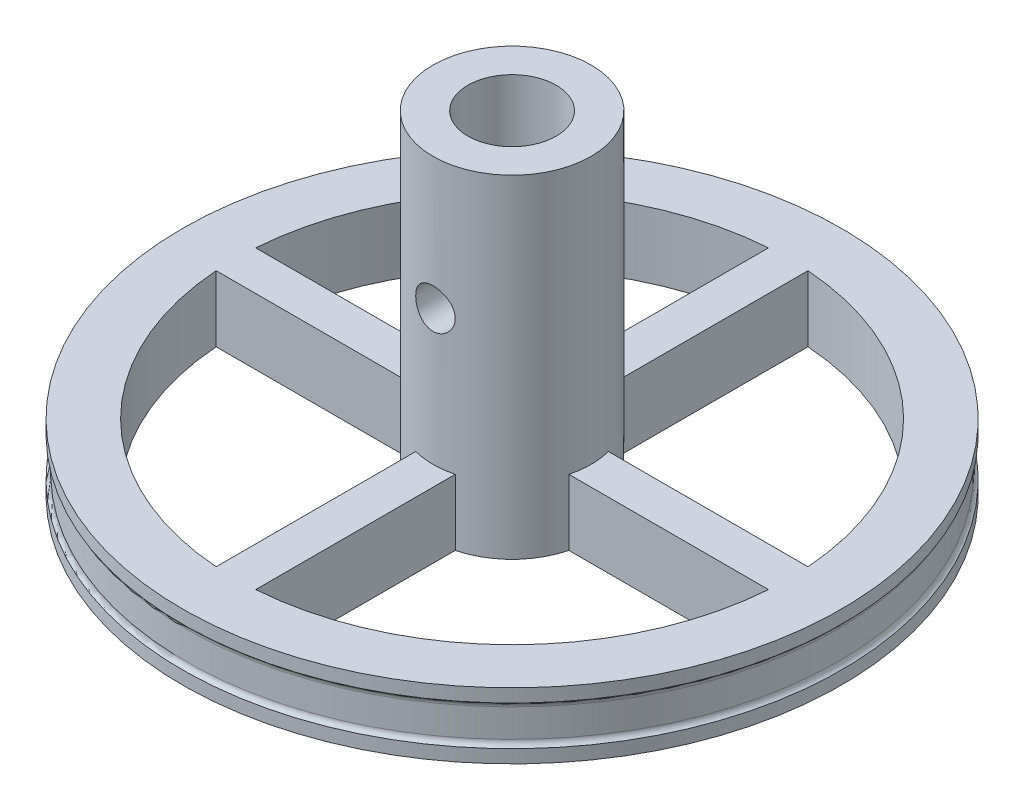
from build123d import *

# Parameters (mm, degrees)
REVOLVE1_ANGLE                 = 90.0000000000002
BOSS_EXTRUDE2_DEPTH            = 22.5
CUT_EXTRUDE1_DEPTH             = 41.736973886583954
MIRROR3_START                  = -2.736132077
MIRROR3_DEPTH                  = 5
MIRROR3_START_2                = 2.263867923
MIRROR3_2_DEPTH                = 20.236132077
MIRROR3_3_DEPTH                = 1
MIRROR3_START_3                = 1.263867923
MIRROR3_4_DEPTH                = 1
MIRROR4_START                  = -2.736132077
MIRROR4_DEPTH                  = 5
MIRROR4_START_2                = 2.263867923
MIRROR4_2_DEPTH                = 20.236132077
MIRROR4_3_DEPTH                = 1
MIRROR4_START_3                = 1.263867923
MIRROR4_4_DEPTH                = 1
SKETCH7_R                      = 3.35
CUT_EXTRUDE2_DEPTH             = 20
FILLET9_R                      = 0.5
CUT_EXTRUDE3_REACH             = 43.908
SKETCH8_R                      = 1.5000000000000004
CUT_EXTRUDE3_DIRECTION_2_REACH = 43.908


# Read off the part's stored shape, not the designer's step: Mirror3, Mirror4
with BuildPart() as part:
    # Sketch1 → Revolve1 (revolve)
    with BuildSketch(Plane.XY):
        Polygon((0, 2.2638679230386933), (0, -2.7361320769613027), (25, -2.7361320769613027), (25.000000000000007, -1.736132076961303), (24.750000000000007, -1.736132076961303), (24.75, 1.2638679230386973), (25, 1.2638679230386973), (25, 2.2638679230386973), align=None)
    revolve(axis=Axis((0, 2.2638679230386933, 0), (0, -1, 0)), revolution_arc=REVOLVE1_ANGLE)

    # Sketch2 → Boss-Extrude2 (add)
    with BuildSketch(Plane(origin=(0, 0, 0), x_dir=(1, 0, 0), z_dir=(0, 1, 0))):
        with BuildLine():
            Line((0, 0), (6, 0))
            ThreePointArc((6, 0), (4.242640687119239, -4.242640687119332), (-1.3093e-13, -6))
            Line((-1.3093e-13, -6), (0, 0))
        make_face()
    extrude(amount=BOSS_EXTRUDE2_DEPTH)

    # Sketch6 → Cut-Extrude1 (cut, through all)
    with BuildSketch(Plane(origin=(0, 2.263867923038695, 0), x_dir=(1, 0, 0), z_dir=(0, 1, 0))):
        with BuildLine():
            Line((1.4999999999999127, -5.809475019311148), (1.4999999999999145, -20.946360065653423))
            ThreePointArc((1.4999999999999145, -20.946360065653423), (14.849242404917469, -14.849242404917533), (20.946360065653415, -1.5))
            Line((20.946360065653415, -1.5), (5.809475019311125, -1.5))
            ThreePointArc((5.809475019311125, -1.5), (4.242640687119254, -4.242640687119317), (1.4999999999999127, -5.809475019311148))
        make_face()
    extrude(amount=-CUT_EXTRUDE1_DEPTH, mode=Mode.SUBTRACT)

    # Mirror3 outline → Mirror3 (add)
    with BuildSketch(Plane(origin=(0, 0, 0), x_dir=(1, 0, 0), z_dir=(0, 1, 0)).offset(MIRROR3_START)):
        with BuildLine():
            ThreePointArc((24.75, 0), (17.500892834, 17.500892834), (0, 24.75))
            Line((0, 24.75), (0, 0))
            Line((0, 0), (24.75, 0))
        make_face()
        with BuildLine():
            Line((20.946360066, 1.5), (5.809475019, 1.5))
            ThreePointArc((5.809475019, 1.5), (4.242640687, 4.242640687), (1.5, 5.809475019))
            Line((1.5, 5.809475019), (1.5, 20.946360066))
            ThreePointArc((1.5, 20.946360066), (14.849242405, 14.849242405), (20.946360066, 1.5))
        make_face(mode=Mode.SUBTRACT)
    extrude(amount=MIRROR3_DEPTH)

    # Mirror3 2 outline → Mirror3 2 (add)
    with BuildSketch(Plane(origin=(0, 0, 0), x_dir=(1, 0, 0), z_dir=(0, 1, 0)).offset(MIRROR3_START_2)):
        with BuildLine():
            Line((0, 0), (6, 0))
            ThreePointArc((6, 0), (4.242640687, 4.242640687), (0, 6))
            Line((0, 6), (0, 0))
        make_face()
    extrude(amount=MIRROR3_2_DEPTH)

    # Mirror3 3 outline → Mirror3 3 (add)
    with BuildSketch(Plane(origin=(0, 0, 0), x_dir=(1, 0, 0), z_dir=(0, 1, 0)).offset(MIRROR3_START)):
        with BuildLine():
            Line((24.75, 0), (25, 0))
            ThreePointArc((25, 0), (17.67766953, 17.67766953), (0, 25))
            Line((0, 25), (0, 24.75))
            ThreePointArc((0, 24.75), (17.500892834, 17.500892834), (24.75, 0))
        make_face()
    extrude(amount=MIRROR3_3_DEPTH)

    # Mirror3 4 outline → Mirror3 4 (add)
    with BuildSketch(Plane(origin=(0, 0, 0), x_dir=(1, 0, 0), z_dir=(0, 1, 0)).offset(MIRROR3_START_3)):
        with BuildLine():
            Line((24.75, 0), (25, 0))
            ThreePointArc((25, 0), (17.67766953, 17.67766953), (0, 25))
            Line((0, 25), (0, 24.75))
            ThreePointArc((0, 24.75), (17.500892834, 17.500892834), (24.75, 0))
        make_face()
    extrude(amount=MIRROR3_4_DEPTH)

    # Mirror4 outline → Mirror4 (add)
    with BuildSketch(Plane(origin=(0, 0, 0), x_dir=(1, 0, 0), z_dir=(0, 1, 0)).offset(MIRROR4_START)):
        with BuildLine():
            ThreePointArc((0, 24.75), (-24.75, 0), (0, -24.75))
            Line((0, -24.75), (0, 24.75))
        make_face()
        with BuildLine():
            Line((-1.5, 20.946360066), (-1.5, 5.809475019))
            ThreePointArc((-1.5, 5.809475019), (-4.242640687, 4.242640687), (-5.809475019, 1.5))
            Line((-5.809475019, 1.5), (-20.946360066, 1.5))
            ThreePointArc((-20.946360066, 1.5), (-14.849242405, 14.849242405), (-1.5, 20.946360066))
        make_face(mode=Mode.SUBTRACT)
        with BuildLine():
            Line((-20.946360066, -1.5), (-5.809475019, -1.5))
            ThreePointArc((-5.809475019, -1.5), (-4.242640687, -4.242640687), (-1.5, -5.809475019))
            Line((-1.5, -5.809475019), (-1.5, -20.946360066))
            ThreePointArc((-1.5, -20.946360066), (-14.849242405, -14.849242405), (-20.946360066, -1.5))
        make_face(mode=Mode.SUBTRACT)
    extrude(amount=MIRROR4_DEPTH)

    # Mirror4 2 outline → Mirror4 2 (add)
    with BuildSketch(Plane(origin=(0, 0, 0), x_dir=(1, 0, 0), z_dir=(0, 1, 0)).offset(MIRROR4_START_2)):
        with BuildLine():
            Line((0, -6), (0, 6))
            ThreePointArc((0, 6), (-6, 0), (0, -6))
        make_face()
    extrude(amount=MIRROR4_2_DEPTH)

    # Mirror4 3 outline → Mirror4 3 (add)
    with BuildSketch(Plane(origin=(0, 0, 0), x_dir=(1, 0, 0), z_dir=(0, 1, 0)).offset(MIRROR4_START)):
        with BuildLine():
            Line((0, 24.75), (0, 25))
            ThreePointArc((0, 25), (-25, 0), (0, -25))
            Line((0, -25), (0, -24.75))
            ThreePointArc((0, -24.75), (-24.75, 0), (0, 24.75))
        make_face()
    extrude(amount=MIRROR4_3_DEPTH)

    # Mirror4 4 outline → Mirror4 4 (add)
    with BuildSketch(Plane(origin=(0, 0, 0), x_dir=(1, 0, 0), z_dir=(0, 1, 0)).offset(MIRROR4_START_3)):
        with BuildLine():
            Line((0, 24.75), (0, 25))
            ThreePointArc((0, 25), (-25, 0), (0, -25))
            Line((0, -25), (0, -24.75))
            ThreePointArc((0, -24.75), (-24.75, 0), (0, 24.75))
        make_face()
    extrude(amount=MIRROR4_4_DEPTH)

    # Sketch7 → Cut-Extrude2 (cut)
    with BuildSketch(Plane(origin=(0, 22.5, 0), x_dir=(1, 0, 0), z_dir=(0, 1, 0))):
        with Locations(Location((0, 0, 0), (0, 0, 270))):
            Circle(SKETCH7_R)
    extrude(amount=-CUT_EXTRUDE2_DEPTH, mode=Mode.SUBTRACT)

    # Fillet9
    # the kernel refuses this fillet: 0.5 mm, written as the material it adds along each edge
    with BuildSketch(Plane(origin=(3.55e-15, 1.263867923, 0), x_dir=(-1.4e-16, 0, 1), z_dir=(1, 0, 1.4e-16))) as fillet9_piece_1:
        with BuildLine():
            CenterArc((25.25, 0.4330127018922456), FILLET9_R, 180, 60.000000000001876)
            Line((25.000000000000014, 1.821e-14), (24.995000000000015, -0.00866025403782644))
            ThreePointArc((24.995000000000015, -0.00866025403782644), (24.875000000000007, -0.01000000000000001), (24.75, -0.01000000000000001))
            Line((24.75, -0.01000000000000001), (24.74, 0))
            Line((24.74, 0), (24.74, 0.4330127018922456))
            Line((24.74, 0.4330127018922456), (24.75, 0.4330127018922456))
        make_face()
    revolve(axis=Axis((3.55e-15, 1.263867923, 0), (0, -1, 0)), revolution_arc=179.99999999999997)
    with BuildSketch(Plane(origin=(3.55e-15, -1.7361320770000002, 0), x_dir=(-1.4e-16, 0, 1), z_dir=(1, 0, 1.4e-16))) as fillet9_piece_2:
        with BuildLine():
            CenterArc((25.25, -0.4330127018922456), FILLET9_R, 119.99999999999814, 60.00000000000186)
            Line((24.75, -0.4330127018922456), (24.74, -0.4330127018922456))
            Line((24.74, -0.4330127018922456), (24.74, 0))
            Line((24.74, 0), (24.75, 0.01000000000000001))
            ThreePointArc((24.75, 0.01000000000000001), (24.875000000000007, 0.01000000000000001), (24.995000000000015, 0.00866025403782644))
            Line((24.995000000000015, 0.00866025403782644), (25.000000000000014, -1.821e-14))
        make_face()
    revolve(axis=Axis((3.55e-15, -1.7361320770000002, 0), (0, -1, 0)), revolution_arc=179.99999999999997)
    with BuildSketch(Plane(origin=(0, -1.7361320769613031, 0), x_dir=(1, 0, 0), z_dir=(0, 0, -1))) as fillet9_piece_3:
        with BuildLine():
            CenterArc((25.250000000000007, -0.4330127018922436), FILLET9_R, 119.9999999999986, 60.00000000000141)
            Line((24.750000000000007, -0.4330127018922436), (24.740000000000006, -0.4330127018922436))
            Line((24.740000000000006, -0.4330127018922436), (24.740000000000006, 0))
            Line((24.740000000000006, 0), (24.750000000000007, 0.01000000000000001))
            ThreePointArc((24.750000000000007, 0.01000000000000001), (24.875000000000014, 0.01000000000000001), (24.99500000000002, 0.00866025403782622))
            Line((24.99500000000002, 0.00866025403782622), (25.000000000000018, -1.821e-14))
        make_face()
    revolve(axis=Axis((0, -1.7361320769613031, 0), (0, -1, 0)), revolution_arc=90.0000000000002)
    with BuildSketch(Plane(origin=(-1.25320021e-09, -1.7361320770000002, 1.25320021e-09), x_dir=(5.063435192760357e-11, 0, -1.0), z_dir=(-1.0, 0, -5.063435192760357e-11))) as fillet9_piece_4:
        with BuildLine():
            CenterArc((25.2500000012532, -0.4330127018922456), FILLET9_R, 119.99999999999814, 60.00000000000186)
            Line((24.7500000012532, -0.4330127018922456), (24.7400000012532, -0.4330127018922456))
            Line((24.7400000012532, -0.4330127018922456), (24.7400000012532, 0))
            Line((24.7400000012532, 0), (24.7500000012532, 0.01000000000000001))
            ThreePointArc((24.7500000012532, 0.01000000000000001), (24.875000001253206, 0.01000000000000001), (24.995000001253217, 0.00866025403782644))
            Line((24.995000001253217, 0.00866025403782644), (25.000000001253213, -1.821e-14))
        make_face()
    revolve(axis=Axis((-1.25320021e-09, -1.7361320770000002, 1.25320021e-09), (0, -1, 0)), revolution_arc=89.99999999419774)
    with BuildSketch(Plane(origin=(0, 1.2638679230386973, 0), x_dir=(1, 0, 0), z_dir=(0, 0, -1))) as fillet9_piece_5:
        with BuildLine():
            CenterArc((25.250000000000007, 0.4330127018922396), FILLET9_R, 180, 60.000000000000455)
            Line((25.00000000000001, 1.821e-14), (24.99500000000001, -0.00866025403782622))
            ThreePointArc((24.99500000000001, -0.00866025403782622), (24.875000000000007, -0.01000000000000001), (24.75, -0.01000000000000001))
            Line((24.75, -0.01000000000000001), (24.74, 0))
            Line((24.74, 0), (24.740000000000006, 0.4330127018922396))
            Line((24.740000000000006, 0.4330127018922396), (24.750000000000007, 0.4330127018922396))
        make_face()
    revolve(axis=Axis((0, 1.2638679230386973, 0), (0, -1, 0)), revolution_arc=90.0000000000002)
    with BuildSketch(Plane(origin=(-1.25320021e-09, 1.263867923, 1.25320021e-09), x_dir=(5.063435192760357e-11, 0, -1.0), z_dir=(-1.0, 0, -5.063435192760357e-11))) as fillet9_piece_6:
        with BuildLine():
            CenterArc((25.2500000012532, 0.4330127018922456), FILLET9_R, 180, 60.000000000001876)
            Line((25.000000001253213, 1.821e-14), (24.995000001253217, -0.00866025403782644))
            ThreePointArc((24.995000001253217, -0.00866025403782644), (24.875000001253206, -0.01000000000000001), (24.7500000012532, -0.01000000000000001))
            Line((24.7500000012532, -0.01000000000000001), (24.7400000012532, 0))
            Line((24.7400000012532, 0), (24.7400000012532, 0.4330127018922456))
            Line((24.7400000012532, 0.4330127018922456), (24.7500000012532, 0.4330127018922456))
        make_face()
    revolve(axis=Axis((-1.25320021e-09, 1.263867923, 1.25320021e-09), (0, -1, 0)), revolution_arc=89.99999999419774)

    # Sketch8 → Cut-Extrude3 (cut, up to next)
    with BuildSketch(Plane.XY, mode=Mode.PRIVATE) as cut_extrude3_sk1:
        with Locations(Location((1.22e-15, 12.499999999999998, 0), (0, 0, 180))):
            Circle(SKETCH8_R)
    cut_extrude3_tool1 = extrude(cut_extrude3_sk1.sketch, amount=CUT_EXTRUDE3_REACH, mode=Mode.PRIVATE) & part.part
    add(cut_extrude3_tool1.solids().sort_by_distance((0, 12.5, 0))[0], mode=Mode.SUBTRACT)

    # Sketch8 → Cut-Extrude3 direction 2 (cut, up to next)
    with BuildSketch(Plane.XY, mode=Mode.PRIVATE) as cut_extrude3_direction_2_sk1:
        with Locations(Location((1.22e-15, 12.499999999999998, 0), (0, 0, 180))):
            Circle(SKETCH8_R)
    cut_extrude3_direction_2_tool1 = extrude(cut_extrude3_direction_2_sk1.sketch, amount=-CUT_EXTRUDE3_DIRECTION_2_REACH, mode=Mode.PRIVATE) & part.part
    add(cut_extrude3_direction_2_tool1.solids().sort_by_distance((0, 12.5, 0))[0], mode=Mode.SUBTRACT)


solid = part.part
